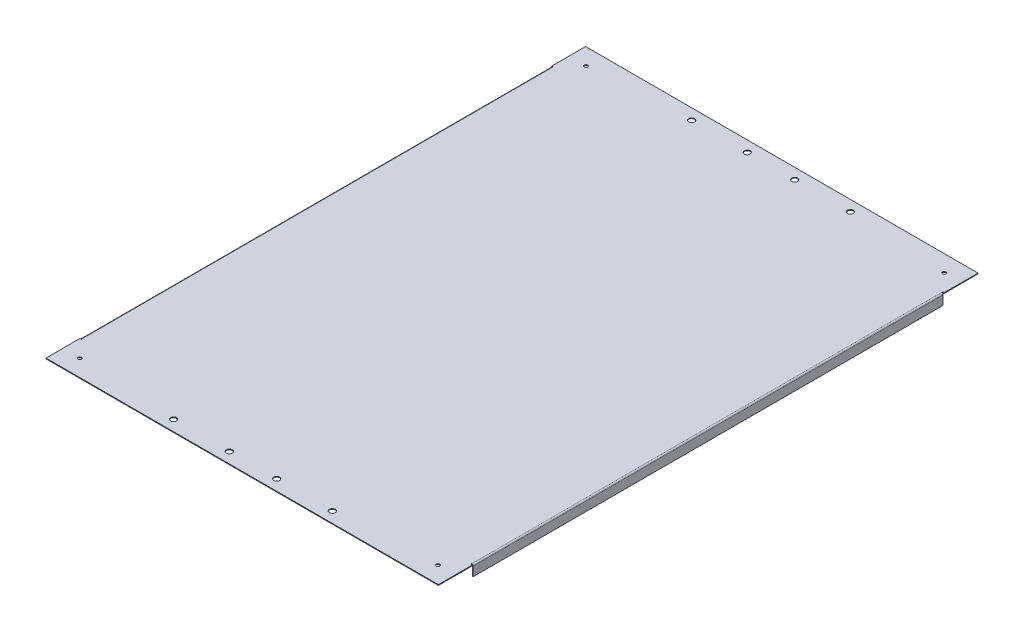
from build123d import *

# Parameters (mm, degrees)
SM_BASE_FLANGE_1_DEPTH   = 550
SKETCH_6_W               = 3
SKETCH_6_H               = 71
CUT_EXTRUDE_1_DEPTH      = 681.413293521
SKETCH_7_W               = 3
SKETCH_7_H               = 69
SM_BASE_FLANGE_1_2_DEPTH = 1.5
SKETCH_10_R              = 3.5
CUT_EXTRUDE_2_DEPTH      = 10
SKETCH_11_R              = 6
CUT_EXTRUDE_1853_DEPTH   = 10


# Sheet-metal steps are written as plain solids
with BuildPart() as part:
    # Sketch 1 → Sm Base Flange 1 (new, symmetric)
    with BuildSketch(Plane.XY):
        with BuildLine():
            Line((-398.5, -20), (-398.5, -1.5))
            ThreePointArc((-398.5, -1.5), (-398.060660172, -0.439339828), (-397, 0))
            Line((-397, 0), (397, 0))
            ThreePointArc((397, 0), (398.060660172, -0.439339828), (398.5, -1.5))
            Line((398.5, -1.5), (398.5, -20))
            Line((398.5, -20), (400, -20))
            Line((400, -20), (400, -1.5))
            ThreePointArc((400, -1.5), (399.121320344, 0.621320344), (397, 1.5))
            Line((397, 1.5), (-397, 1.5))
            ThreePointArc((-397, 1.5), (-399.121320344, 0.621320344), (-400, -1.5))
            Line((-400, -1.5), (-400, -20))
            Line((-400, -20), (-398.5, -20))
        make_face()
    extrude(amount=SM_BASE_FLANGE_1_DEPTH, both=True)

    # Эскиз6 → Вырез-Вытянуть1 (cut, through all)
    with BuildSketch(Plane(origin=(0, 1.5, 0), x_dir=(1, 0, 0), z_dir=(0, 1, 0))):
        with Locations((398.5, -514.5)):
            Rectangle(SKETCH_6_W, SKETCH_6_H)
        with Locations((398.5, 514.5)):
            Rectangle(SKETCH_6_W, SKETCH_6_H)
        with Locations((-398.5, 514.5)):
            Rectangle(SKETCH_6_W, SKETCH_6_H)
        with Locations((-398.5, -514.5)):
            Rectangle(SKETCH_6_W, SKETCH_6_H)
    extrude(amount=-CUT_EXTRUDE_1_DEPTH, mode=Mode.SUBTRACT)

    # Эскиз7 → Sm Base Flange 1 2 (add)
    with BuildSketch(Plane(origin=(0, 1.5, 0), x_dir=(1, 0, 0), z_dir=(0, 1, 0))):
        with Locations((398.5, -515.5)):
            Rectangle(SKETCH_7_W, SKETCH_7_H)
        with Locations((398.5, 515.5)):
            Rectangle(SKETCH_7_W, SKETCH_7_H)
        with Locations((-398.5, 515.5)):
            Rectangle(SKETCH_7_W, SKETCH_7_H)
        with Locations((-398.5, -515.5)):
            Rectangle(SKETCH_7_W, SKETCH_7_H)
    extrude(amount=-SM_BASE_FLANGE_1_2_DEPTH)

    # Эскиз10 → Вырез-Вытянуть2 (cut)
    with BuildSketch(Plane(origin=(0, 1.5, 0), x_dir=(1, 0, 0), z_dir=(0, 1, 0))):
        with Locations(Location((365, -516, 0), (0, 0, 270))):
            Circle(SKETCH_10_R)
        with Locations(Location((365, 516, 0), (0, 0, 90))):
            Circle(SKETCH_10_R)
        with Locations(Location((-365, 516, 0), (0, 0, 270))):
            Circle(SKETCH_10_R)
        with Locations(Location((-365, -516, 0), (0, 0, 90))):
            Circle(SKETCH_10_R)
    extrude(amount=-CUT_EXTRUDE_2_DEPTH, mode=Mode.SUBTRACT)

    # Эскиз11 → Cut-Extrude 1853 (cut)
    with BuildSketch(Plane(origin=(0, 1.5, 0), x_dir=(1, 0, 0), z_dir=(0, 1, 0))):
        with Locations(Location((161.75, -528, 0), (0, 0, 270))):
            Circle(SKETCH_11_R)
        with Locations(Location((48.25, -528, 0), (0, 0, 270))):
            Circle(SKETCH_11_R)
        with Locations(Location((48.25, 528, 0), (0, 0, 90))):
            Circle(SKETCH_11_R)
        with Locations(Location((161.75, 528, 0), (0, 0, 90))):
            Circle(SKETCH_11_R)
        with Locations(Location((-161.75, 528, 0), (0, 0, 270))):
            Circle(SKETCH_11_R)
        with Locations(Location((-48.25, 528, 0), (0, 0, 270))):
            Circle(SKETCH_11_R)
        with Locations(Location((-48.25, -528, 0), (0, 0, 90))):
            Circle(SKETCH_11_R)
        with Locations(Location((-161.75, -528, 0), (0, 0, 90))):
            Circle(SKETCH_11_R)
    extrude(amount=-CUT_EXTRUDE_1853_DEPTH, mode=Mode.SUBTRACT)


solid = part.part
